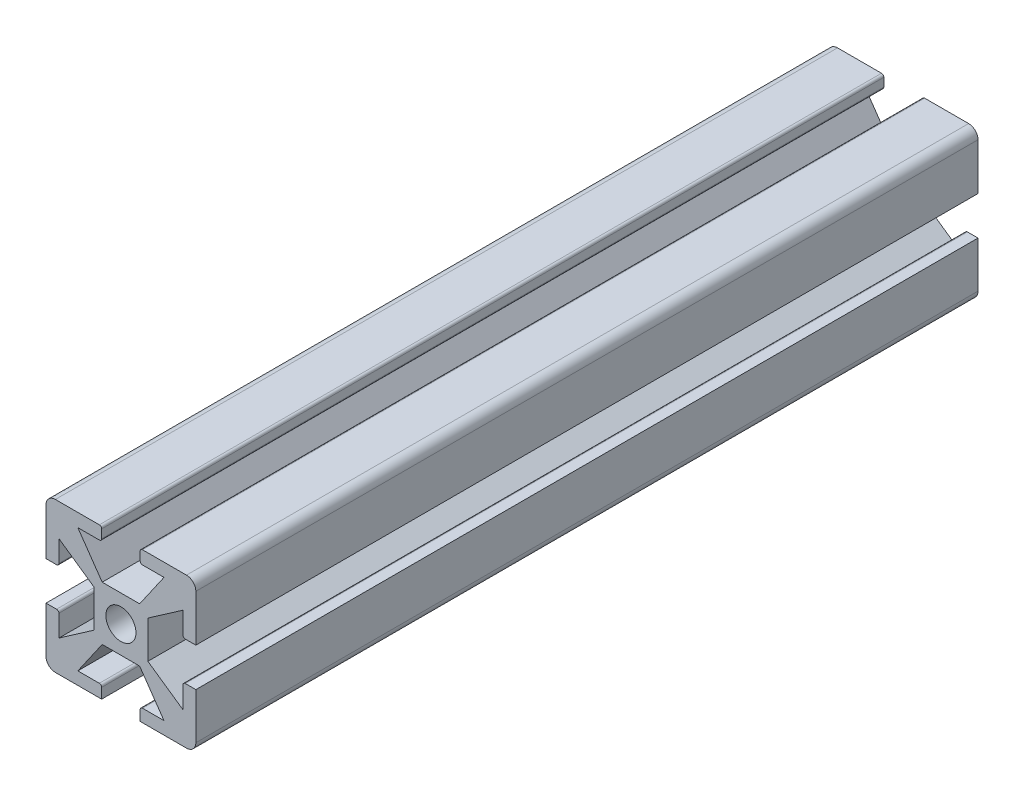
from build123d import *

# Parameters (mm, degrees)
SKETCH1_W           = 25.4
SKETCH1_H           = 25.4
BOSS_EXTRUDE1_DEPTH = 132.588
FILLET1_R           = 1.5875
HOLE1_OUTLINE_R     = 2.5527
HOLE1_DEPTH         = 132.588
SKETCH7_W           = 6.5278
SKETCH7_H           = 2.2352
CUT_EXTRUDE2_DEPTH  = 132.588
FILLET4_R           = 0.396875
CIRPATTERN2_DEPTH   = 132.588


# Read off the part's stored shape, not the designer's step: Hole1, CirPattern2
with BuildPart() as part:
    # Sketch1 → Boss-Extrude1 (new body)
    with BuildSketch(Plane.XY):
        Rectangle(SKETCH1_W, SKETCH1_H)
    extrude(amount=BOSS_EXTRUDE1_DEPTH)

    # Fillet1
    fillet1_edges = [part.edges().sort_by_distance(p)[0] for p in [
        (12.7, -12.7, 66.294),
        (-12.7, -12.7, 66.294),
        (-12.7, 12.7, 66.294),
        (12.7, 12.7, 66.294),
    ]]
    fillet(fillet1_edges, radius=FILLET1_R)

    # Hole1 outline → Hole1 (cut)
    with BuildSketch(Plane.XY):
        with Locations((0, -0.048792482)):
            Circle(HOLE1_OUTLINE_R)
    extrude(amount=HOLE1_DEPTH, mode=Mode.SUBTRACT)

    # Sketch7 → Cut-Extrude2 (cut)
    with BuildSketch(Plane.XY.offset(132.588)):
        with Locations((0, 11.5824)):
            Rectangle(SKETCH7_W, SKETCH7_H)
        Polygon((-3.175, 4.5212), (-7.3025, 10.4648), (7.3025, 10.4648), (3.175, 4.5212), align=None)
    extrude(amount=-CUT_EXTRUDE2_DEPTH, mode=Mode.SUBTRACT)

    # Fillet4
    fillet4_edges = [part.edges().sort_by_distance(p)[0] for p in [
        (-3.2639, 10.4648, 66.294),
        (-3.2639, 12.7, 66.294),
        (3.2639, 12.7, 66.294),
        (3.2639, 10.4648, 66.294),
    ]]
    fillet(fillet4_edges, radius=FILLET4_R)

    # CirPattern2 outline → CirPattern2 (cut)
    with BuildSketch(Plane.XY):
        with BuildLine():
            ThreePointArc((-3.660775, -10.562384964), (-3.380141996, -10.67862696), (-3.2639, -10.959259964))
            Line((-3.2639, -10.959259964), (-3.2639, -12.7))
            Line((-3.2639, -12.7), (3.2639, -12.7))
            Line((3.2639, -12.7), (3.2639, -10.959259964))
            ThreePointArc((3.2639, -10.959259964), (3.380141996, -10.67862696), (3.660775, -10.562384964))
            Line((3.660775, -10.562384964), (7.3025, -10.562384964))
            Line((7.3025, -10.562384964), (3.175, -4.618784964))
            Line((3.175, -4.618784964), (-3.175, -4.618784964))
            Line((-3.175, -4.618784964), (-7.3025, -10.562384964))
            Line((-7.3025, -10.562384964), (-3.660775, -10.562384964))
        make_face()
        with BuildLine():
            Line((-12.7, -3.312692482), (-10.910467482, -3.312692482))
            ThreePointArc((-10.910467482, -3.312692482), (-10.629834478, -3.428934478), (-10.513592482, -3.709567482))
            Line((-10.513592482, -3.709567482), (-10.513592482, -7.351292482))
            Line((-10.513592482, -7.351292482), (-4.569992482, -3.223792482))
            Line((-4.569992482, -3.223792482), (-4.569992482, 3.126207518))
            Line((-4.569992482, 3.126207518), (-10.513592482, 7.253707518))
            Line((-10.513592482, 7.253707518), (-10.513592482, 3.611982518))
            ThreePointArc((-10.513592482, 3.611982518), (-10.629834478, 3.331349514), (-10.910467482, 3.215107518))
            Line((-10.910467482, 3.215107518), (-12.7, 3.215107518))
            Line((-12.7, 3.215107518), (-12.7, -3.312692482))
        make_face()
        with BuildLine():
            ThreePointArc((10.513592482, -3.709567482), (10.629834478, -3.428934478), (10.910467482, -3.312692482))
            Line((10.910467482, -3.312692482), (12.7, -3.312692482))
            Line((12.7, -3.312692482), (12.7, 3.215107518))
            Line((12.7, 3.215107518), (10.910467482, 3.215107518))
            ThreePointArc((10.910467482, 3.215107518), (10.629834478, 3.331349514), (10.513592482, 3.611982518))
            Line((10.513592482, 3.611982518), (10.513592482, 7.253707518))
            Line((10.513592482, 7.253707518), (4.569992482, 3.126207518))
            Line((4.569992482, 3.126207518), (4.569992482, -3.223792482))
            Line((4.569992482, -3.223792482), (10.513592482, -7.351292482))
            Line((10.513592482, -7.351292482), (10.513592482, -3.709567482))
        make_face()
    extrude(amount=CIRPATTERN2_DEPTH, mode=Mode.SUBTRACT)


solid = part.part
